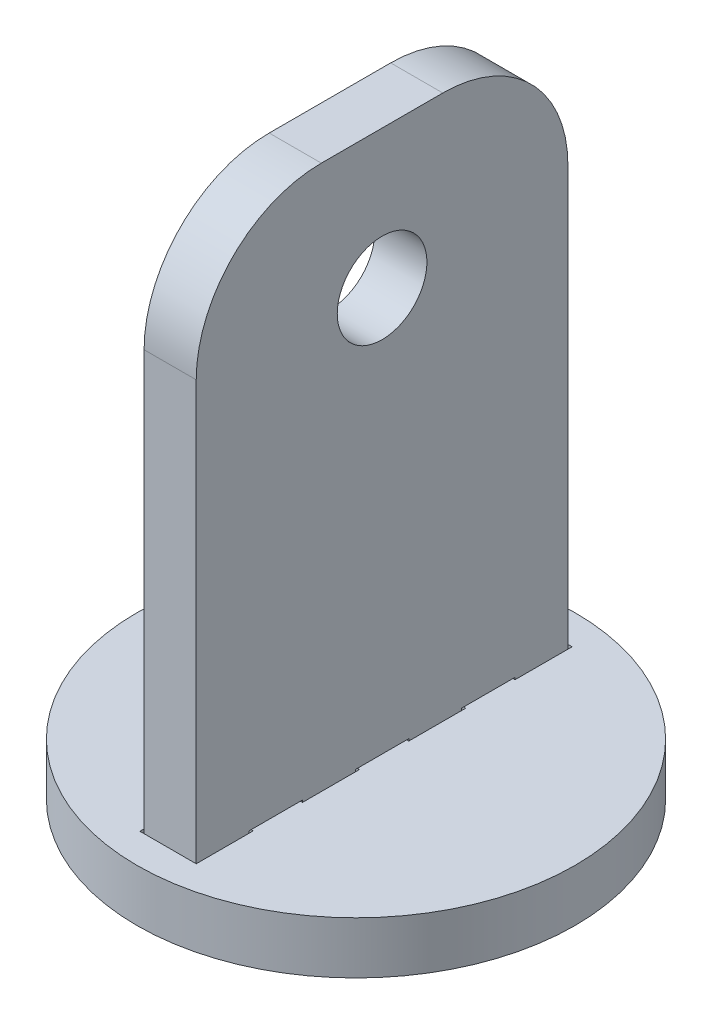
from build123d import *

# Parameters (mm, degrees)
SKETCH1_R                     = 10.5
BOSS_EXTRUDE1_DEPTH           = 2.5
SKETCH2_W                     = 2.5
SKETCH2_H                     = 17.82554347
BOSS_EXTRUDE2_DEPTH           = 26
SKETCH5_W                     = 2.15
SKETCH5_H                     = 11.75
FILLET1_R                     = 6
TAB_START                     = -8.912771735
TAB_AND_SLOT_TAB1_OUTLINE_W   = 2.5
TAB_AND_SLOT_TAB1_OUTLINE_H   = 2.5
TAB_AND_SLOT_TAB1_DEPTH       = 2.535714286
TAB_START_2                   = -3.816162007
TAB_AND_SLOT_TAB1_2_OUTLINE_W = 2.5
TAB_AND_SLOT_TAB1_2_OUTLINE_H = 2.5
TAB_AND_SLOT_TAB1_2_DEPTH     = 2.535714286
TAB_START_3                   = 1.280447721
TAB_AND_SLOT_TAB1_3_OUTLINE_W = 2.5
TAB_AND_SLOT_TAB1_3_OUTLINE_H = 2.5
TAB_AND_SLOT_TAB1_3_DEPTH     = 2.535714286
TAB_START_4                   = 6.377057449
TAB_AND_SLOT_TAB1_4_OUTLINE_W = 2.5
TAB_AND_SLOT_TAB1_4_OUTLINE_H = 2.5
TAB_AND_SLOT_TAB1_4_DEPTH     = 2.535714286
TAB_START_5                   = -1.35
TAB_AND_SLOT_SLOT1_OUTLINE_W  = 2.5
TAB_AND_SLOT_SLOT1_OUTLINE_H  = 2.735714286
TAB_AND_SLOT_SLOT1_DEPTH      = 2.7


with BuildPart() as part:
    # Sketch1 → Boss-Extrude1 (new body)
    with BuildSketch(Plane(origin=(0, 0, 0), x_dir=(1, 0, 0), z_dir=(0, 1, 0))):
        with Locations(Location((0, 0, 0), (0, 0, 270))):
            Circle(SKETCH1_R)
    extrude(amount=BOSS_EXTRUDE1_DEPTH)

    # Tab and Slot-Slot1: read off the stored shape, not the designer's step
    # Tab and Slot-Slot1 outline → Tab and Slot-Slot1 (cut)
    with BuildSketch(Plane.YZ.offset(TAB_START_5)):
        with Locations((1.25, -7.644914592)):
            Rectangle(TAB_AND_SLOT_SLOT1_OUTLINE_W, TAB_AND_SLOT_SLOT1_OUTLINE_H)
        with Locations((1.25, -2.548304864)):
            Rectangle(TAB_AND_SLOT_SLOT1_OUTLINE_W, TAB_AND_SLOT_SLOT1_OUTLINE_H)
        with Locations((1.25, 2.548304864)):
            Rectangle(TAB_AND_SLOT_SLOT1_OUTLINE_W, TAB_AND_SLOT_SLOT1_OUTLINE_H)
        with Locations((1.25, 7.644914592)):
            Rectangle(TAB_AND_SLOT_SLOT1_OUTLINE_W, TAB_AND_SLOT_SLOT1_OUTLINE_H)
    extrude(amount=TAB_AND_SLOT_SLOT1_DEPTH, mode=Mode.SUBTRACT)


with BuildPart() as body_2:
    # Sketch2 → Boss-Extrude2 (new body)
    with BuildSketch(Plane(origin=(0, 2.5, 0), x_dir=(1, 0, 0), z_dir=(0, 1, 0))):
        Rectangle(SKETCH2_W, SKETCH2_H)
    extrude(amount=BOSS_EXTRUDE2_DEPTH)

    # Sketch5 → M4 Clearance Hole1 (revolve, cut)
    with BuildSketch(Plane(origin=(-1.25, 21.86, 0), x_dir=(0, 0, 1), z_dir=(0, 1, 0))):
        with Locations((1.075, 5.875)):
            Rectangle(SKETCH5_W, SKETCH5_H)
    revolve(axis=Axis((-7.6, 21.86, 0), (1, 0, 0)), mode=Mode.SUBTRACT)

    # Fillet1
    fillet1_edges = [body_2.edges().sort_by_distance(p)[0] for p in [
        (0, 28.5, -8.912771735),
        (0, 28.5, 8.912771735),
    ]]
    fillet(fillet1_edges, radius=FILLET1_R)

    # Tab and Slot-Tab1: read off the stored shape, not the designer's step
    # Tab and Slot-Tab1 outline → Tab and Slot-Tab1 (add)
    with BuildSketch(Plane.XY.offset(TAB_START)):
        with Locations((0, 1.25)):
            Rectangle(TAB_AND_SLOT_TAB1_OUTLINE_W, TAB_AND_SLOT_TAB1_OUTLINE_H)
    extrude(amount=TAB_AND_SLOT_TAB1_DEPTH)

    # Tab and Slot-Tab1 2 outline → Tab and Slot-Tab1 2 (add)
    with BuildSketch(Plane.XY.offset(TAB_START_2)):
        with Locations((0, 1.25)):
            Rectangle(TAB_AND_SLOT_TAB1_2_OUTLINE_W, TAB_AND_SLOT_TAB1_2_OUTLINE_H)
    extrude(amount=TAB_AND_SLOT_TAB1_2_DEPTH)

    # Tab and Slot-Tab1 3 outline → Tab and Slot-Tab1 3 (add)
    with BuildSketch(Plane.XY.offset(TAB_START_3)):
        with Locations((0, 1.25)):
            Rectangle(TAB_AND_SLOT_TAB1_3_OUTLINE_W, TAB_AND_SLOT_TAB1_3_OUTLINE_H)
    extrude(amount=TAB_AND_SLOT_TAB1_3_DEPTH)

    # Tab and Slot-Tab1 4 outline → Tab and Slot-Tab1 4 (add)
    with BuildSketch(Plane.XY.offset(TAB_START_4)):
        with Locations((0, 1.25)):
            Rectangle(TAB_AND_SLOT_TAB1_4_OUTLINE_W, TAB_AND_SLOT_TAB1_4_OUTLINE_H)
    extrude(amount=TAB_AND_SLOT_TAB1_4_DEPTH)


solid = Compound([part.part, body_2.part])
